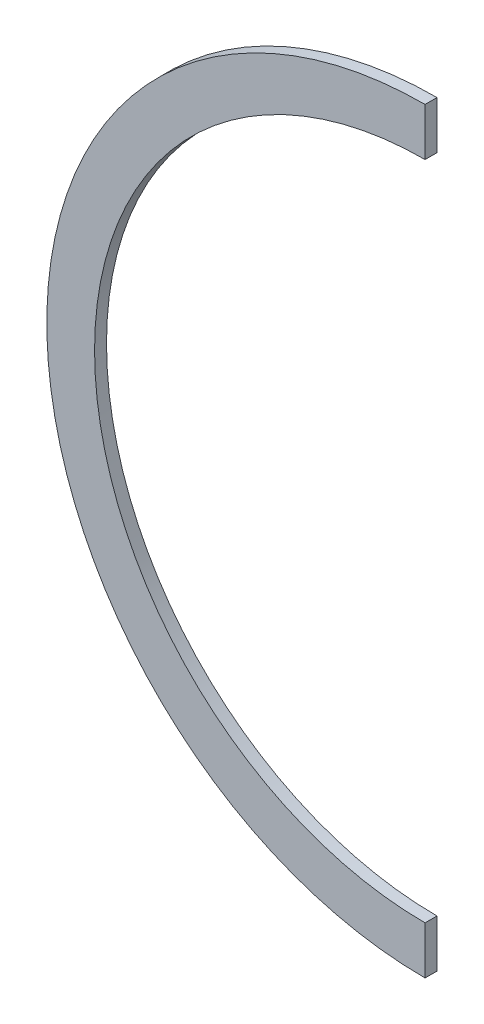
from build123d import *

# Parameters (mm, degrees)
BOSS_EXTRUDE1_DEPTH = 3.175
SKETCH3_W           = 149.303507008
SKETCH3_H           = 288.678903575
CUT_EXTRUDE1_DEPTH  = 147.667755045


with BuildPart() as part:
    # Sketch2 → Boss-Extrude1 (new body)
    with BuildSketch(Plane.XY):
        with BuildLine():
            ThreePointArc((-1.783927604, 106.664181958), (-86.289926541, 57.796410124), (-89.548347912, -39.767444199))
            ThreePointArc((-89.548347912, -39.767444199), (-89.139366423, -40.557656379), (-88.723411943, -41.344220438))
            ThreePointArc((-88.723411943, -41.344220438), (-88.300763494, -42.126623343), (-87.87121564, -42.905259753))
            ThreePointArc((-87.87121564, -42.905259753), (0, -94.523651503), (87.87121564, -42.905259753))
            ThreePointArc((87.87121564, -42.905259753), (88.300763494, -42.126623343), (88.723411943, -41.344220438))
            ThreePointArc((88.723411943, -41.344220438), (89.139366423, -40.557656379), (89.548347912, -39.767444199))
            ThreePointArc((89.548347912, -39.767444199), (86.289926541, 57.796410124), (1.783927604, 106.664181958))
            ThreePointArc((1.783927604, 106.664181958), (0.891998866, 106.676045412), (0, 106.68))
            ThreePointArc((0, 106.68), (-0.891998866, 106.676045412), (-1.783927604, 106.664181958))
        make_face()
        with BuildLine():
            ThreePointArc((-7.652045127, 93.646303016), (0, -81.823651503), (7.652045127, 93.646303016))
            ThreePointArc((7.652045127, 93.646303016), (4.717664566, 93.853310885), (1.778000524, 93.962016248))
            ThreePointArc((1.778000524, 93.962016248), (0.889045735, 93.975503947), (0, 93.98))
            ThreePointArc((0, 93.98), (-0.889045735, 93.975503947), (-1.778000524, 93.962016248))
            ThreePointArc((-1.778000524, 93.962016248), (-4.717664566, 93.853310885), (-7.652045127, 93.646303016))
        make_face(mode=Mode.SUBTRACT)
    extrude(amount=-BOSS_EXTRUDE1_DEPTH)

    # Sketch3 → Cut-Extrude1 (cut, through all)
    with BuildSketch(Plane(origin=(0, 0, 0), x_dir=(0, 0, -1), z_dir=(1, 0, 0))):
        with Locations((2.160275602, 8.369276658)):
            Rectangle(SKETCH3_W, SKETCH3_H)
    extrude(amount=CUT_EXTRUDE1_DEPTH, mode=Mode.SUBTRACT)


solid = part.part
